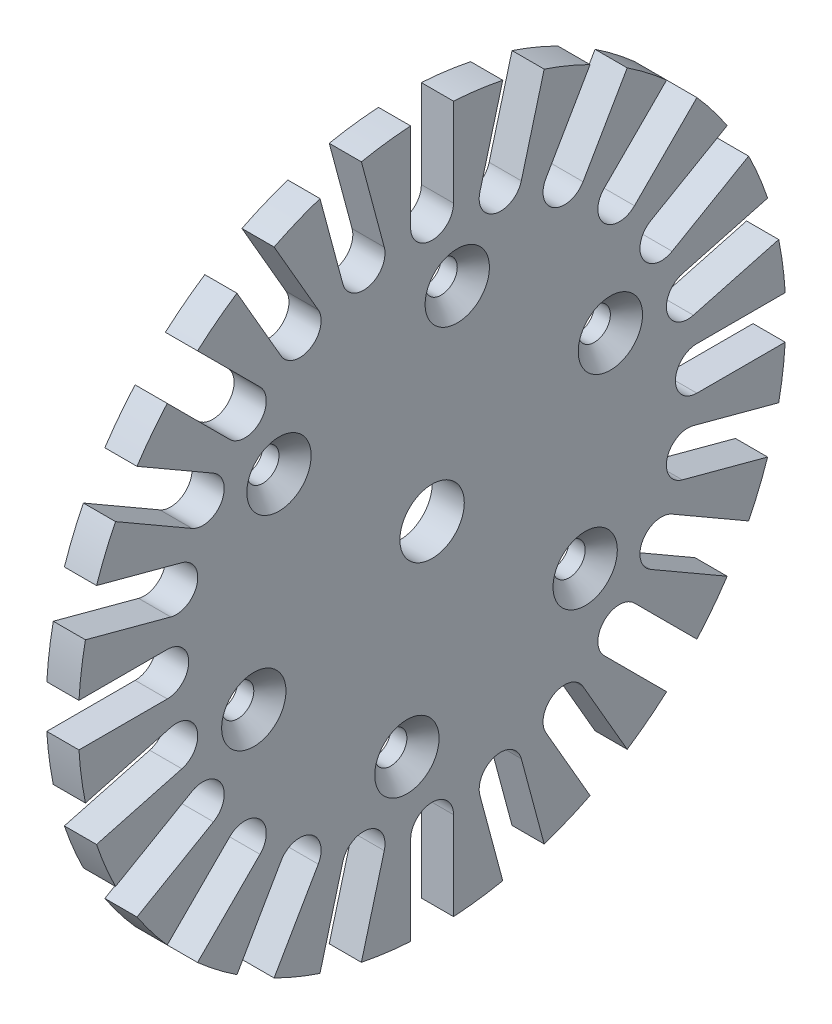
from build123d import *

# Parameters (mm, degrees)
SKETCH1_R                    = 33
BOSS_EXTRUDE1_DEPTH          = 3
CUT_EXTRUDE2_REACH           = 48.765
SKETCH3_R                    = 3.005
CUT_EXTRUDE3_REACH           = 48.765
CIRPATTERN2_COUNT            = 24
CUT_EXTRUDE1_REACH           = 48.68
SKETCH2_R                    = 1.5
CHAMFER1_SIZE                = 1.5
CIRPATTERN1_COUNT            = 6
CHAMFER1_OF_CIRPATTERN1_SIZE = 1.5


with BuildPart() as part:
    # Sketch1 → Boss-Extrude1 (new body)
    with BuildSketch(Plane(origin=(0, 0, 0), x_dir=(0, 0, -1), z_dir=(1, 0, 0))):
        Circle(SKETCH1_R)
    extrude(amount=BOSS_EXTRUDE1_DEPTH)

    # Sketch3 → Cut-Extrude2 (cut, up to next)
    with BuildSketch(Plane(origin=(3, 0, 0), x_dir=(0, 0, -1), z_dir=(1, 0, 0)), mode=Mode.PRIVATE) as cut_extrude2_sk1:
        Circle(SKETCH3_R)
    cut_extrude2_tool1 = extrude(cut_extrude2_sk1.sketch, amount=-CUT_EXTRUDE2_REACH, mode=Mode.PRIVATE) & part.part
    add(cut_extrude2_tool1.solids().sort_by_distance((3, 0, 0))[0], mode=Mode.SUBTRACT)

    # Sketch4 → Cut-Extrude3 (cut, up to next)
    with BuildSketch(Plane(origin=(3, 0, 0), x_dir=(0, 0, -1), z_dir=(1, 0, 0)), mode=Mode.PRIVATE) as cut_extrude3_sk1:
        with BuildLine():
            Line((-2, 33), (-2, 24.7))
            ThreePointArc((-2, 24.7), (0, 22.7), (2, 24.7))
            Line((2, 24.7), (2, 33))
            Line((2, 33), (-2, 33))
        make_face()
    cut_extrude3_tool1 = extrude(cut_extrude3_sk1.sketch, amount=-CUT_EXTRUDE3_REACH, mode=Mode.PRIVATE) & part.part
    cut_extrude3 = cut_extrude3_tool1.solids().sort_by_distance((3, 28.054508, 0))[0]
    add(cut_extrude3, mode=Mode.SUBTRACT)

    # CirPattern2: Cut-Extrude3 ×24 about axis
    cirpattern2_axis = Axis((3, 0, 0), (1, 0, 0))
    for i in range(1, CIRPATTERN2_COUNT):
        add(cut_extrude3.rotate(cirpattern2_axis, i * 360 / CIRPATTERN2_COUNT), mode=Mode.SUBTRACT)

    # Sketch2 → Cut-Extrude1 (cut, up to next)
    with BuildSketch(Plane(origin=(3, 0, 0), x_dir=(0, 0, -1), z_dir=(1, 0, 0)), mode=Mode.PRIVATE) as cut_extrude1_sk1:
        with Locations((2.34947146, 17.846007505)):
            Circle(SKETCH2_R)
    cut_extrude1_tool1 = extrude(cut_extrude1_sk1.sketch, amount=-CUT_EXTRUDE1_REACH, mode=Mode.PRIVATE) & part.part
    cut_extrude1 = cut_extrude1_tool1.solids().sort_by_distance((3, 17.846008, -2.349471))[0]
    add(cut_extrude1, mode=Mode.SUBTRACT)

    # Chamfer1
    chamfer1_edges = [part.edges().sort_by_distance(p)[0] for p in [
        (3, 17.846007505, -0.84947146),
    ]]
    chamfer(chamfer1_edges, length=CHAMFER1_SIZE)

    # CirPattern1: Cut-Extrude1 ×6 about axis
    cirpattern1_axis = Axis((3, 0, 0), (1, 0, 0))
    for i in range(1, CIRPATTERN1_COUNT):
        add(cut_extrude1.rotate(cirpattern1_axis, i * 360 / CIRPATTERN1_COUNT), mode=Mode.SUBTRACT)

    # Chamfer1 of CirPattern1
    chamfer1_of_cirpattern1_edges = [part.edges().sort_by_distance(p)[0] for p in [
        (3, 9.658667616, 15.030360125),
        (3, -8.187339888, 15.879831585),
        (3, -17.846007505, 0.84947146),
        (3, -9.658667616, -15.030360125),
        (3, 8.187339888, -15.879831585),
    ]]
    chamfer(chamfer1_of_cirpattern1_edges, length=CHAMFER1_OF_CIRPATTERN1_SIZE)


solid = part.part
